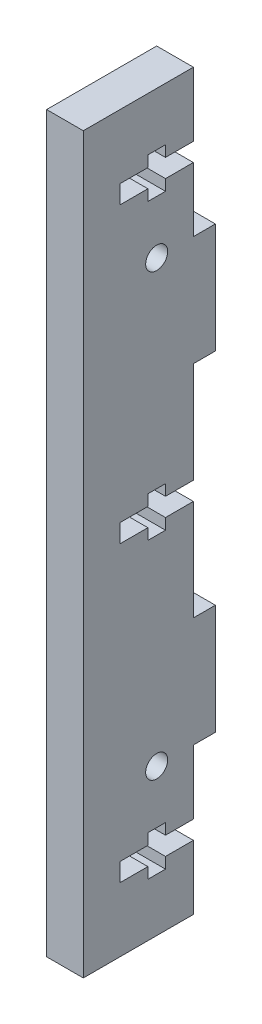
from build123d import *

# Parameters (mm, degrees)
SCHIZZO1_W                   = 15
SCHIZZO1_H                   = 100
ESTRUSIONE_ESTRUSIONE1_DEPTH = 5
SCHIZZO2_W                   = 5
SCHIZZO2_H                   = 15
ESTRUSIONE_ESTRUSIONE2_DEPTH = 3
SCHIZZO4_R                   = 1.5
TAGLIO_ESTRUSIONE2_DEPTH     = 52.334686129
TAGLIO_ESTRUSIONE3_DEPTH     = 52.334686129


with BuildPart() as part:
    # Schizzo1 → Estrusione-Estrusione1 (new body)
    with BuildSketch(Plane(origin=(0, 0, 0), x_dir=(0, 0, -1), z_dir=(1, 0, 0))):
        Rectangle(SCHIZZO1_W, SCHIZZO1_H)
    extrude(amount=ESTRUSIONE_ESTRUSIONE1_DEPTH)

    # Schizzo2 → Estrusione-Estrusione2 (add)
    with BuildSketch(Plane(origin=(0, 0, -7.5), x_dir=(-1, 0, 0), z_dir=(0, 0, -1))):
        with Locations((-2.5, 22.5)):
            Rectangle(SCHIZZO2_W, SCHIZZO2_H)
        with Locations((-2.5, -22.5)):
            Rectangle(SCHIZZO2_W, SCHIZZO2_H)
    extrude(amount=ESTRUSIONE_ESTRUSIONE2_DEPTH)

    # Schizzo4 → Taglio-Estrusione2 (cut, through all)
    with BuildSketch(Plane(origin=(0, 0, 0), x_dir=(0, 0, -1), z_dir=(1, 0, 0))):
        with Locations((2.5, 30)):
            Circle(SCHIZZO4_R)
        with Locations((2.5, -30)):
            Circle(SCHIZZO4_R)
    extrude(amount=TAGLIO_ESTRUSIONE2_DEPTH, mode=Mode.SUBTRACT)

    # Schizzo5 → Taglio-Estrusione3 (cut, through all)
    with BuildSketch(Plane(origin=(5, 0, 0), x_dir=(0, 0, -1), z_dir=(1, 0, 0))):
        Polygon((-2.5, 1.25), (1.3, 1.25), (1.3, 2.75), (3.7, 2.75), (3.7, 1.25), (7.5, 1.25), (7.5, -1.25), (3.7, -1.25), (3.7, -2.75), (1.3, -2.75), (1.3, -1.25), (-2.5, -1.25), align=None)
        Polygon((-2.5, -38.75), (1.3, -38.75), (1.3, -37.25), (3.7, -37.25), (3.7, -38.75), (7.5, -38.75), (7.5, -41.25), (3.7, -41.25), (3.7, -42.75), (1.3, -42.75), (1.3, -41.25), (-2.5, -41.25), align=None)
        Polygon((7.5, 38.75), (7.5, 41.25), (3.7, 41.25), (3.7, 42.75), (1.3, 42.75), (1.3, 41.25), (-2.5, 41.25), (-2.5, 38.75), (1.3, 38.75), (1.3, 37.25), (3.7, 37.25), (3.7, 38.75), align=None)
    extrude(amount=-TAGLIO_ESTRUSIONE3_DEPTH, mode=Mode.SUBTRACT)


solid = part.part
